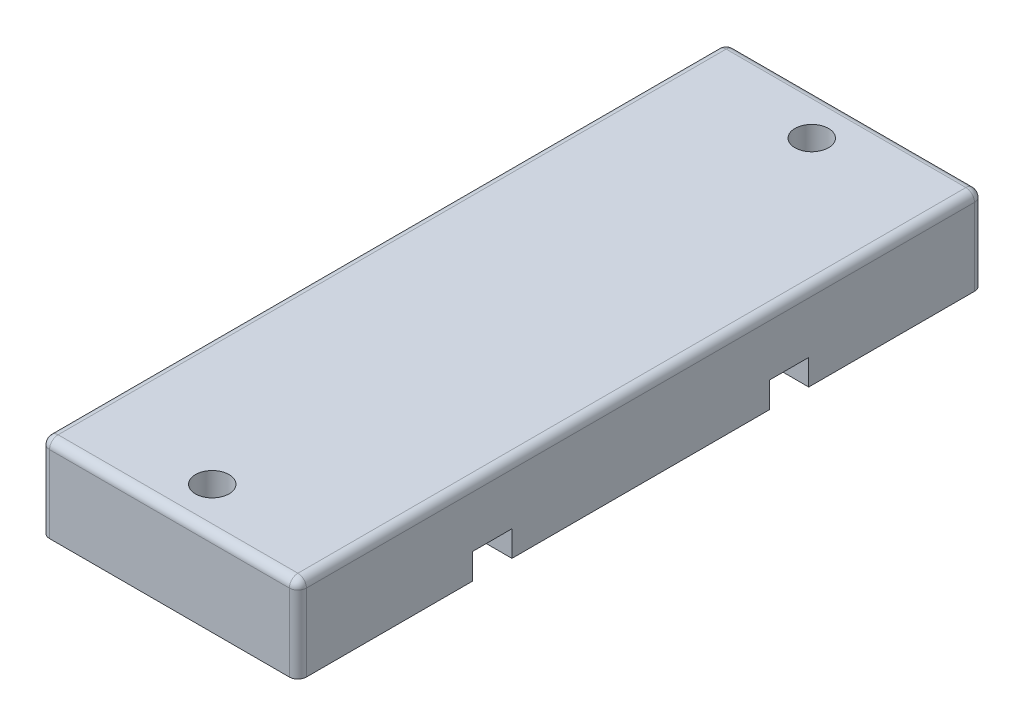
from build123d import *

# Parameters (mm, degrees)
SKETCH1_W                    = 38.1
SKETCH1_H                    = 101.6
BOSS_EXTRUDE1_DEPTH          = 12.7
SKETCH12_W                   = 5.8382662
SKETCH12_H                   = 3.81
CUT_EXTRUDE1_DEPTH           = 110.249530891
FILLET2_R                    = 1.27
F_10_0_1935_DIAMETER_HOLE2_D = 4.9784


with BuildPart() as part:
    # Sketch1 → Boss-Extrude1 (new body)
    with BuildSketch(Plane(origin=(0, 0, 0), x_dir=(1, 0, 0), z_dir=(0, 1, 0))):
        with Locations((19.05, 50.8)):
            Rectangle(SKETCH1_W, SKETCH1_H)
    extrude(amount=BOSS_EXTRUDE1_DEPTH)

    # Sketch12 → Cut-Extrude1 (cut, through all)
    with BuildSketch(Plane.ZY):
        with Locations((-72.8347159, 1.905)):
            Rectangle(SKETCH12_W, SKETCH12_H)
        with Locations((-28.8219007, 1.905)):
            Rectangle(SKETCH12_W, SKETCH12_H)
    extrude(amount=-CUT_EXTRUDE1_DEPTH, mode=Mode.SUBTRACT)

    # Fillet2
    fillet2_edges = [part.edges().sort_by_distance(p)[0] for p in [
        (38.1, 6.35, -101.6),
        (38.1, 12.7, -50.8),
        (38.1, 6.35, 0),
        (19.05, 12.7, 0),
        (0, 6.35, 0),
        (19.05, 12.7, -101.6),
        (0, 12.7, -50.8),
        (0, 6.35, -101.6),
    ]]
    fillet(fillet2_edges, radius=FILLET2_R)

    # #10 (0.1935) Diameter Hole2 (through all)
    with Locations(Plane(origin=(0, 12.7, 0), x_dir=(1, 0, 0), z_dir=(0, 1, 0))):
        with Locations((19.05, 95.25), (19.05, 6.35)):
            Hole(F_10_0_1935_DIAMETER_HOLE2_D / 2)


solid = part.part
